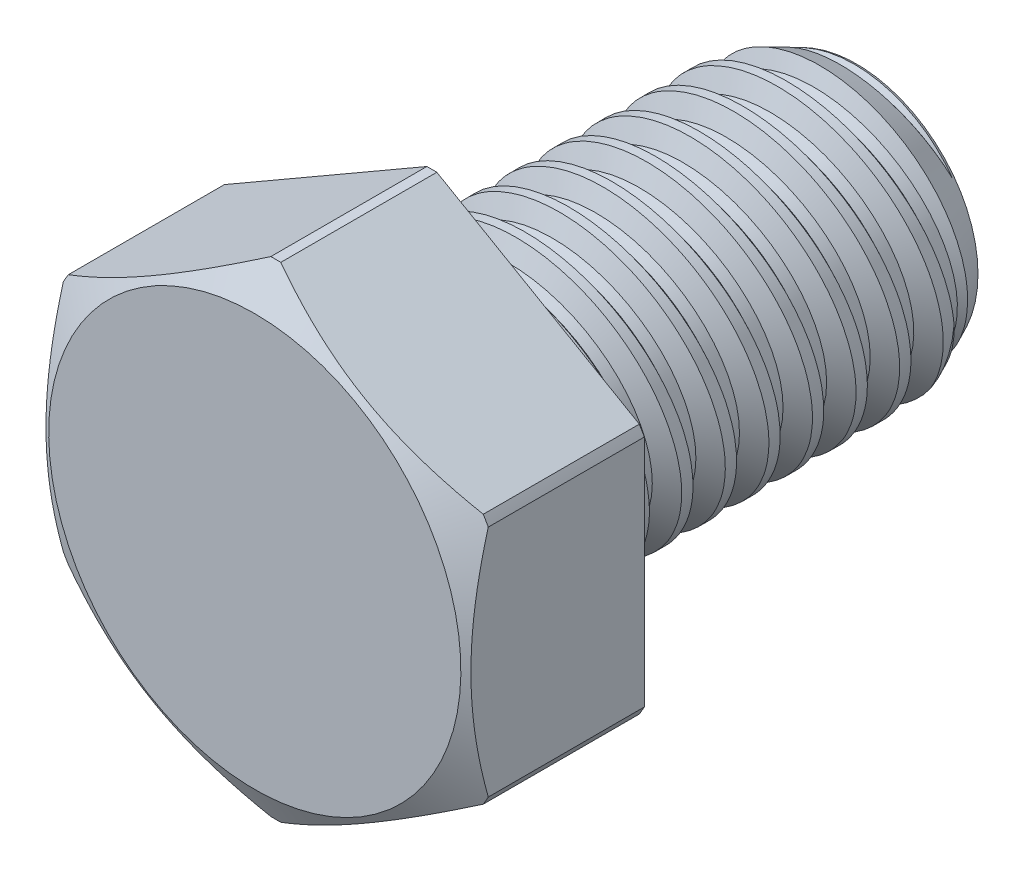
from build123d import *

# Parameters (mm, degrees)
SKETCH1_W            = 19.05
SKETCH1_H            = 6.35
LPATTERN1_COUNT      = 2
LPATTERN1_PITCH      = 1.953846154
LPATTERN1_COUNT_DIR2 = 10
LPATTERN1_PITCH_DIR2 = 1.953846154
EXTRUDE1_DEPTH       = 7.9375


with BuildPart() as part:
    # Sketch1 → Revolve1 (revolve)
    with BuildSketch(Plane(origin=(0, 0, 0), x_dir=(0, 0, -1), z_dir=(1, 0, 0)), mode=Mode.PRIVATE) as revolve1_sk:
        with Locations((0, 3.175)):
            Rectangle(SKETCH1_W, SKETCH1_H)
    revolve(revolve1_sk.sketch.rotate(Axis((0, 0, 9.525), (0, 0, 1)), 124.694557523), axis=Axis((0, 0, 9.525), (0, 0, 1)))

    # Sketch2 → Cut-Revolve1 (revolve, cut)
    with BuildSketch(Plane(origin=(0, 0, 0), x_dir=(0, 0, -1), z_dir=(1, 0, 0)), mode=Mode.PRIVATE) as cut_revolve1_sk:
        Polygon((-7.59387376, 6.647096345), (-9.28360922, 6.387137043), (-8.519324156, 5.434726912), (-8.036542596, 5.509000998), align=None)
    cut_revolve1 = revolve(cut_revolve1_sk.sketch.rotate(Axis((0, -0.321367977, 9.525), (0, 0.15205718425394155, -0.9883716976506172)), 180), axis=Axis((0, -0.321367977, 9.525), (0, 0.15205718425394155, -0.9883716976506172)), mode=Mode.SUBTRACT)

    # Sketch3 → Cut-Revolve2 (revolve, cut)
    with BuildSketch(Plane(origin=(0, 0, 0), x_dir=(0, 0, -1), z_dir=(1, 0, 0)), mode=Mode.PRIVATE) as cut_revolve2_sk:
        Polygon((7.562190529, 6.35), (9.525, 5.434726912), (9.525, 6.35), align=None)
    revolve(cut_revolve2_sk.sketch.rotate(Axis((0, 0, 0), (0, 0, -1)), 235.305442477), axis=Axis((0, 0, 0), (0, 0, -1)), mode=Mode.SUBTRACT)

    # LPattern1: Cut-Revolve1 2 × 10
    with Locations(*[Vector(0, 0, 1) * (i * LPATTERN1_PITCH) + Vector(0, 0, -1) * (j * LPATTERN1_PITCH_DIR2) for i in range(LPATTERN1_COUNT) for j in range(LPATTERN1_COUNT_DIR2) if (i, j) != (0, 0)]):
        add(cut_revolve1, mode=Mode.SUBTRACT)

    # Sketch5 → Extrude1 (add)
    with BuildSketch(Plane.XY.offset(9.525)):
        Polygon((0, 10.998522628), (-9.525, 5.499261314), (-9.525, -5.499261314), (0, -10.998522628), (9.525, -5.499261314), (9.525, 5.499261314), align=None)
    extrude(amount=EXTRUDE1_DEPTH)

    # Sketch6 → Cut-Revolve3 (revolve, cut)
    with BuildSketch(Plane(origin=(0, 0, 0), x_dir=(0, 0, -1), z_dir=(1, 0, 0)), mode=Mode.PRIVATE) as cut_revolve3_sk:
        Polygon((-17.4625, 9.23925), (-16.520106959, 10.871522628), (-9.525, 10.871522628), (-9.525, 11.379522628), (-17.4625, 11.379522628), align=None)
    revolve(cut_revolve3_sk.sketch.rotate(Axis((0, 0, 0), (0, 0, 1)), 328.864041857), axis=Axis((0, 0, 0), (0, 0, 1)), mode=Mode.SUBTRACT)


solid = part.part
